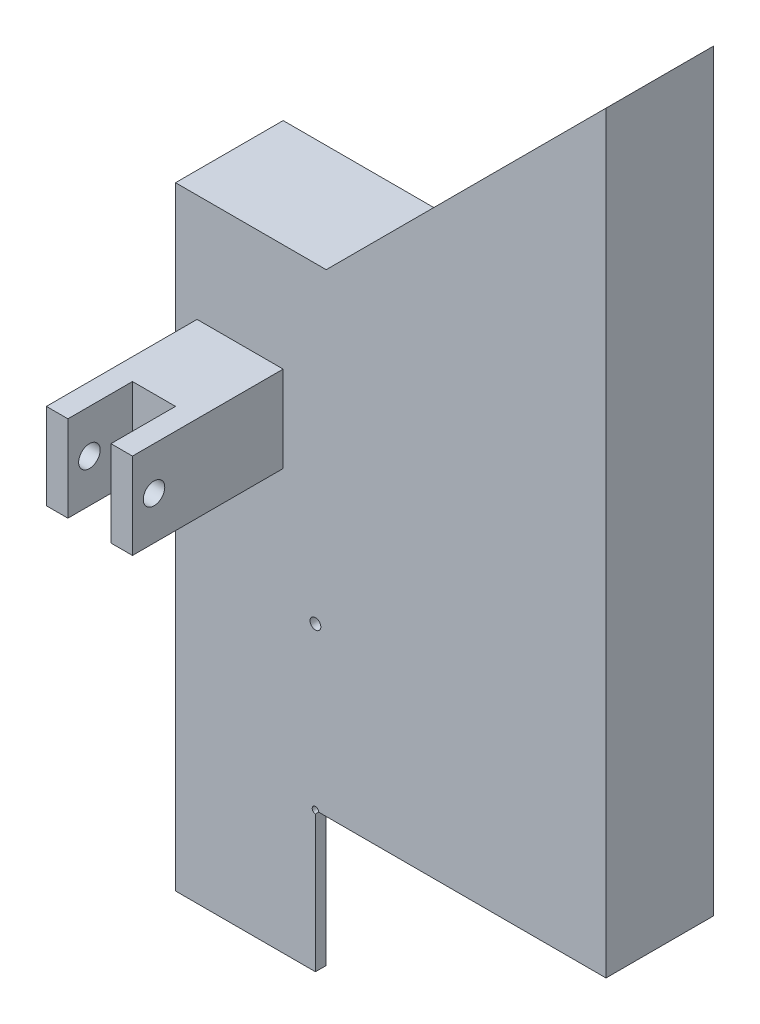
from build123d import *

# Parameters (mm, degrees)
P_IDAT_VYSUNUT_M1_DEPTH  = 50
SKICA2_W                 = 130
SKICA2_H                 = 5
P_IDAT_VYSUNUT_M2_DEPTH  = 65
SKICA3_W                 = 65
SKICA3_H                 = 65
ODEBRAT_VYSUNUT_M1_DEPTH = 5
SKICA4_W                 = 40
SKICA4_H                 = 40
P_IDAT_VYSUNUT_M3_DEPTH  = 40
SKICA5_W                 = 10
SKICA5_H                 = 40
P_IDAT_VYSUNUT_M4_DEPTH  = 30
SKICA6_R                 = 5
ODEBRAT_VYSUNUT_M2_DEPTH = 40
SKICA7_R                 = 2.5
ODEBRAT_VYSUNUT_M3_DEPTH = 55
SKICA8_R                 = 1.5
ODEBRAT_VYSUNUT_M4_DEPTH = 50


with BuildPart() as part:
    # Skica1 → Přidat vysunutím1 (new body)
    with BuildSketch(Plane.XY):
        Polygon((0, 0), (200, 0), (200, 350), (70, 220), (0, 220), align=None)
    extrude(amount=P_IDAT_VYSUNUT_M1_DEPTH)

    # Skica2 → Přidat vysunutím2 (add)
    with BuildSketch(Plane.XZ):
        with Locations((65, 47.5)):
            Rectangle(SKICA2_W, SKICA2_H)
    extrude(amount=P_IDAT_VYSUNUT_M2_DEPTH)

    # Skica3 → Odebrat vysunutím1 (cut)
    with BuildSketch(Plane.XY.offset(50)):
        with Locations((97.5, -32.5)):
            Rectangle(SKICA3_W, SKICA3_H)
    extrude(amount=-ODEBRAT_VYSUNUT_M1_DEPTH, mode=Mode.SUBTRACT)

    # Skica4 → Přidat vysunutím3 (add)
    with BuildSketch(Plane.XY.offset(50)):
        with Locations((30, 150)):
            Rectangle(SKICA4_W, SKICA4_H)
    extrude(amount=P_IDAT_VYSUNUT_M3_DEPTH)

    # Skica5 → Přidat vysunutím4 (add)
    with BuildSketch(Plane.XY.offset(90)):
        with Locations((15, 150)):
            Rectangle(SKICA5_W, SKICA5_H)
        with Locations((45, 150)):
            Rectangle(SKICA5_W, SKICA5_H)
    extrude(amount=P_IDAT_VYSUNUT_M4_DEPTH)

    # Skica6 → Odebrat vysunutím2 (cut)
    with BuildSketch(Plane(origin=(50, 0, 0), x_dir=(0, 0, -1), z_dir=(1, 0, 0))):
        with Locations((-110, 150)):
            Circle(SKICA6_R)
    extrude(amount=-ODEBRAT_VYSUNUT_M2_DEPTH, mode=Mode.SUBTRACT)

    # Skica7 → Odebrat vysunutím3 (cut)
    with BuildSketch(Plane.XY.offset(50)):
        with Locations((65, 75)):
            Circle(SKICA7_R)
    extrude(amount=-ODEBRAT_VYSUNUT_M3_DEPTH, mode=Mode.SUBTRACT)

    # Skica8 → Odebrat vysunutím4 (cut)
    with BuildSketch(Plane.XY.offset(50)):
        with Locations((65, 0)):
            Circle(SKICA8_R)
    extrude(amount=-ODEBRAT_VYSUNUT_M4_DEPTH, mode=Mode.SUBTRACT)


solid = part.part
